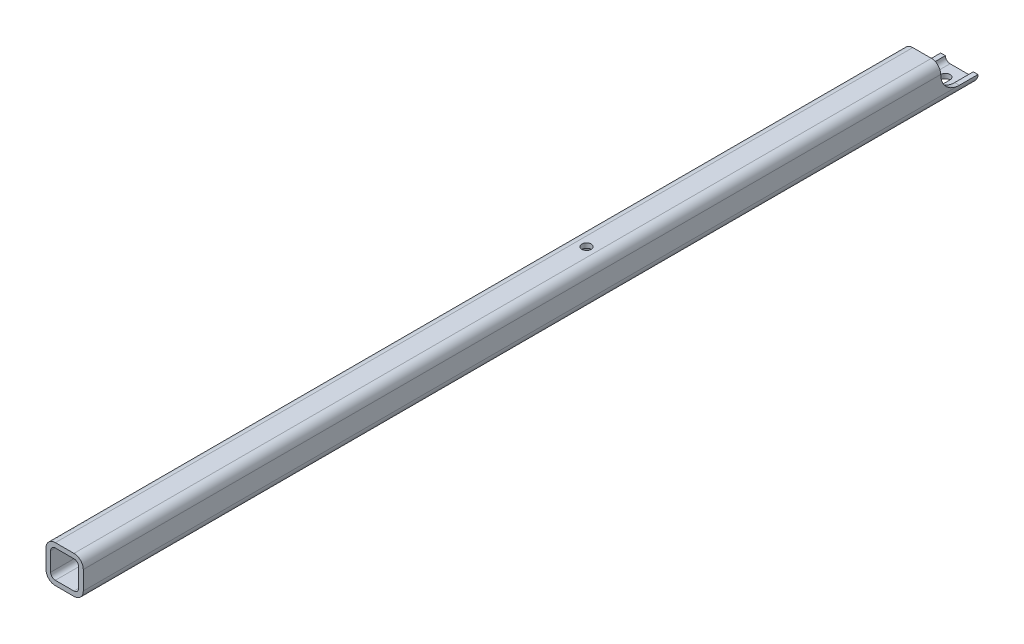
from build123d import *

# Parameters (mm, degrees)
BOSS_EXTRUDE1_DEPTH        = 609.6
F_1_2_0_5_DIAMETER_HOLE1_D = 12.7
SKETCH8_W                  = 50.8
SKETCH8_H                  = 38.1
CUT_EXTRUDE2_DEPTH         = 614.818735459
CUT_EXTRUDE3_REACH         = 615.819
FILLET1_R                  = 25.4


with BuildPart() as part:
    # Sketch1 → Boss-Extrude1 (new, symmetric)
    with BuildSketch(Plane.XY):
        with BuildLine():
            Line((12.7, 0), (38.1, 0))
            ThreePointArc((38.1, 0), (47.080256121, 3.719743879), (50.8, 12.7))
            Line((50.8, 12.7), (50.8, 38.1))
            ThreePointArc((50.8, 38.1), (47.080256121, 47.080256121), (38.1, 50.8))
            Line((38.1, 50.8), (12.7, 50.8))
            ThreePointArc((12.7, 50.8), (3.719743879, 47.080256121), (0, 38.1))
            Line((0, 38.1), (0, 12.7))
            ThreePointArc((0, 12.7), (3.719743879, 3.719743879), (12.7, 0))
        make_face()
        with BuildLine():
            Line((12.7, 6.35), (38.1, 6.35))
            ThreePointArc((38.1, 6.35), (42.590128061, 8.209871939), (44.45, 12.7))
            Line((44.45, 12.7), (44.45, 38.1))
            ThreePointArc((44.45, 38.1), (42.590128061, 42.590128061), (38.1, 44.45))
            Line((38.1, 44.45), (12.7, 44.45))
            ThreePointArc((12.7, 44.45), (8.209871939, 42.590128061), (6.35, 38.1))
            Line((6.35, 38.1), (6.35, 12.7))
            ThreePointArc((6.35, 12.7), (8.209871939, 8.209871939), (12.7, 6.35))
        make_face(mode=Mode.SUBTRACT)
    extrude(amount=BOSS_EXTRUDE1_DEPTH, both=True)

    # 1/2 (0.5) Diameter Hole1 (through all)
    with Locations(Plane(origin=(0, 50.8, 0), x_dir=(-1, 0, 0), z_dir=(0, 1, 0))):
        with Locations((-25.4, -101.6)):
            Hole(F_1_2_0_5_DIAMETER_HOLE1_D / 2)

    # Sketch8 → Cut-Extrude2 (cut, through all)
    with BuildSketch(Plane(origin=(50.8, 0, 0), x_dir=(0, 0, -1), z_dir=(1, 0, 0))):
        with Locations((584.2, 31.75)):
            Rectangle(SKETCH8_W, SKETCH8_H)
    extrude(amount=-CUT_EXTRUDE2_DEPTH, mode=Mode.SUBTRACT)

    # Sketch9 → Cut-Extrude3 (cut, up to next)
    with BuildSketch(Plane.XZ, mode=Mode.PRIVATE) as cut_extrude3_sk1:
        with BuildLine():
            Line((19.05, -590.55), (19.05, -571.5))
            ThreePointArc((19.05, -571.5), (25.4, -565.15), (31.75, -571.5))
            Line((31.75, -571.5), (31.75, -590.55))
            ThreePointArc((31.75, -590.55), (25.4, -596.9), (19.05, -590.55))
        make_face()
    cut_extrude3_tool1 = extrude(cut_extrude3_sk1.sketch, amount=-CUT_EXTRUDE3_REACH, mode=Mode.PRIVATE) & part.part
    add(cut_extrude3_tool1.solids().sort_by_distance((25.4, 0, -581.025))[0], mode=Mode.SUBTRACT)

    # Fillet1
    fillet1_edges = [part.edges().sort_by_distance(p)[0] for p in [
        (3.175, 12.7, -558.8),
        (47.625, 12.7, -558.8),
    ]]
    fillet(fillet1_edges, radius=FILLET1_R)


solid = part.part
